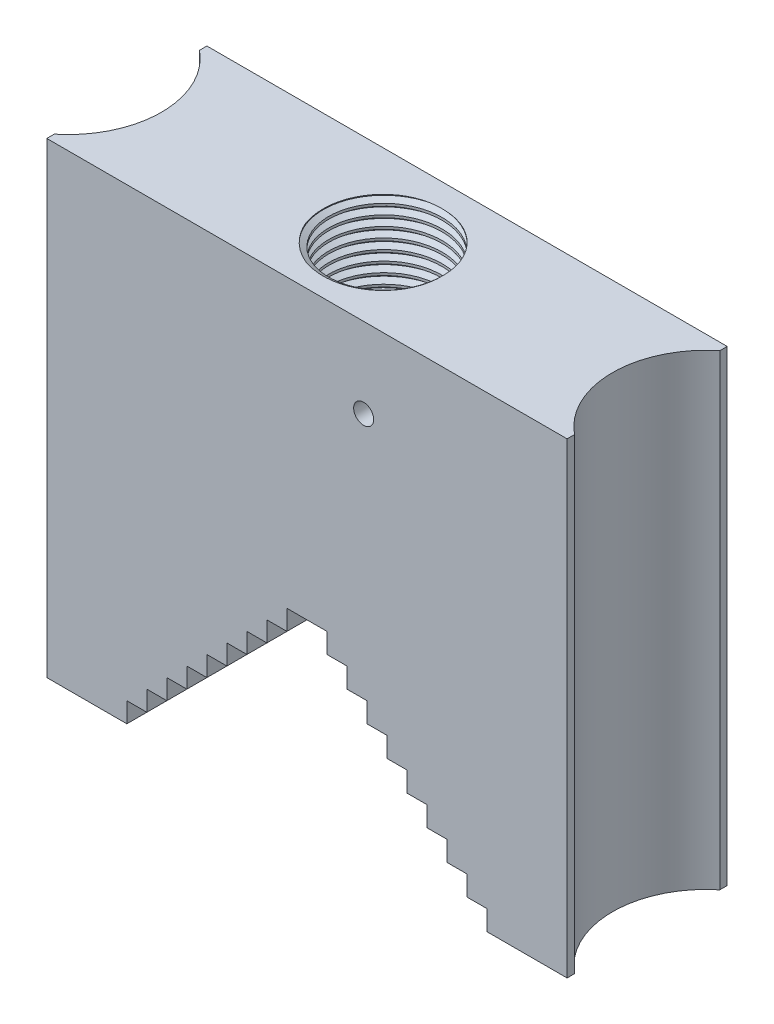
from build123d import *

# Parameters (mm, degrees)
SKETCH1_R               = 8.5
BOSS_EXTRUDE1_DEPTH     = 70
SKETCH1_3_R             = 8.5
CUT_EXTRUDE1_DEPTH      = 24
CUT_EXTRUDE2_DEPTH      = 84.648072303
CUT_EXTRUDE2_DEPTH_BACK = 40
SKETCH2_R               = 1.5
THREAD1_PITCH           = 1.5


with BuildPart() as part:
    # Sketch1 → Boss-Extrude1 (new body)
    # profile 1 of 2: a face of its own
    with BuildSketch(Plane(origin=(0, 0, 0), x_dir=(1, 0, 0), z_dir=(0, 1, 0))):
        with BuildLine():
            Line((39, -10.888526071), (39, -12))
            Line((39, -12), (-39, -12))
            Line((-39, -12), (-39, -10.888526071))
            ThreePointArc((-39, -10.888526071), (-33.8, 0), (-39, 10.888526071))
            Line((-39, 10.888526071), (-39, 12))
            Line((-39, 12), (39, 12))
            Line((39, 12), (39, 10.888526071))
            ThreePointArc((39, 10.888526071), (33.8, 0), (39, -10.888526071))
        make_face()
        Circle(SKETCH1_R, mode=Mode.SUBTRACT)
    # profile 2 of 2: a face of its own
    with BuildSketch(Plane(origin=(0, 0, 0), x_dir=(1, 0, 0), z_dir=(0, 1, 0))):
        Circle(SKETCH1_R)
    extrude(amount=-BOSS_EXTRUDE1_DEPTH)

    # Sketch1<3> → Cut-Extrude1 (cut)
    with BuildSketch(Plane(origin=(0, 0, 0), x_dir=(1, 0, 0), z_dir=(0, 1, 0))):
        with Locations(Location((0, 0, 0), (0, 0, 270))):
            Circle(SKETCH1_3_R)
    extrude(amount=-CUT_EXTRUDE1_DEPTH, mode=Mode.SUBTRACT)

    # Sketch2 → Cut-Extrude2 (cut, two sides: drawn at the far end of the back side and taken through both)
    with BuildSketch(Plane.XY.offset(12).offset(-CUT_EXTRUDE2_DEPTH_BACK)):
        Polygon((-27, -67), (-27, -70), (27, -70), (27, -67), (24, -67), (24, -64), (21, -64), (21, -61), (18, -61), (18, -58), (15, -58), (15, -55), (12, -55), (12, -52), (9, -52), (9, -49), (6, -49), (6, -46), (3, -46), (3, -43), (-3, -43), (-3, -46), (-6, -46), (-6, -49), (-9, -49), (-9, -52), (-12, -52), (-12, -55), (-15, -55), (-15, -58), (-18, -58), (-18, -61), (-21, -61), (-21, -64), (-24, -64), (-24, -67), align=None)
        with Locations((8.5, -12)):
            Circle(SKETCH2_R)
    extrude(amount=CUT_EXTRUDE2_DEPTH + CUT_EXTRUDE2_DEPTH_BACK, mode=Mode.SUBTRACT)

    # Thread1: the profile of Thread Profile1 profile screwed along a right-hand helix of 16.666667 turns, 8 arcs to a turn; built about Z, then put on its axis
    thread1_z = Axis((0, 0, 0), (0, 0, 1))
    thread1_corners = [(8.4997, 0, -0.000173205), (9.311898813, 0, 0.468749998), (9.311898813, 0, 0.656249998), (8.4997, 0, 1.125173201)]
    with BuildLine(mode=Mode.PRIVATE) as thread1_profile:
        Line(thread1_corners[0], thread1_corners[1])
        Line(thread1_corners[1], thread1_corners[2])
        Line(thread1_corners[2], thread1_corners[3])
        Line(thread1_corners[3], thread1_corners[0])
    thread1_cap = Face(thread1_profile.wire())
    thread1_turn_angles = [0, 22.5, 45, 67.5, 90, 112.5, 135, 157.5, 180, 202.5, 225, 247.5, 270, 292.5, 315, 337.5, 360]
    thread1_turn_weights = [1, 0.9238795325112867, 1, 0.9238795325112867, 1, 0.9238795325112867, 1, 0.9238795325112867, 1, 0.9238795325112867, 1, 0.9238795325112867, 1, 0.9238795325112867, 1, 0.9238795325112867, 1]
    thread1_turn_rails = [Edge.make_bspline([Vector(p[0], p[1], 0).rotate(thread1_z, thread1_turn_angles[k]) / thread1_turn_weights[k] + Vector(0, 0, p[2] + THREAD1_PITCH * thread1_turn_angles[k] / 360) for k in range(17)], [0, 0, 0, 1, 1, 2, 2, 3, 3, 4, 4, 5, 5, 6, 6, 7, 7, 8, 8, 8], 2, thread1_turn_weights) for p in thread1_corners]
    thread1_turn_sides = [Face.make_surface_from_curves(thread1_turn_rails[p[0]], thread1_turn_rails[p[1]]) for p in [(0, 1), (1, 2), (2, 3), (3, 0)]]
    thread1_last_angles = [5760, 5782.5, 5805, 5827.5, 5850, 5872.5, 5895, 5917.5, 5940, 5962.5, 5985, 5992.5, 6000]
    thread1_last_weights = [1, 0.9238795325112867, 1, 0.9238795325112867, 1, 0.9238795325112867, 1, 0.9238795325112867, 1, 0.9238795325112867, 1, 0.9914448613738115, 1]
    thread1_last_rails = [Edge.make_bspline([Vector(p[0], p[1], 0).rotate(thread1_z, thread1_last_angles[k]) / thread1_last_weights[k] + Vector(0, 0, p[2] + THREAD1_PITCH * thread1_last_angles[k] / 360) for k in range(13)], [0, 0, 0, 1, 1, 2, 2, 3, 3, 4, 4, 5, 5, 6, 6, 6], 2, thread1_last_weights) for p in thread1_corners]
    thread1_last_sides = [Face.make_surface_from_curves(thread1_last_rails[p[0]], thread1_last_rails[p[1]]) for p in [(0, 1), (1, 2), (2, 3), (3, 0)]]
    thread1 = Plane(origin=(0, -24, 0), x_dir=(1, 0, 0), z_dir=(0, 1, 0)) * Solid(Shell([*[p.moved(Location((0, 0, THREAD1_PITCH * i))) for i in range(16) for p in thread1_turn_sides], *thread1_last_sides, thread1_cap, thread1_cap.rotate(thread1_z, 6000).moved(Location((0, 0, THREAD1_PITCH * 6000 / 360)))]))
    add(thread1, mode=Mode.SUBTRACT)


solid = part.part
